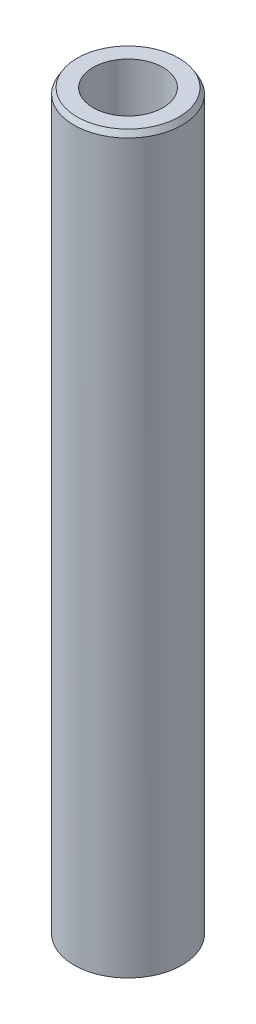
from build123d import *
from OCP.BRepFilletAPI import BRepFilletAPI_MakeChamfer

# Parameters (mm, degrees)
SKETCH1_R           = 7.5
BOSS_EXTRUDE1_DEPTH = 102.049210947
SKETCH2_R           = 4.845715464
CUT_EXTRUDE1_DEPTH  = 103.59893496
CHAMFER1_SIZE       = 0.762633897
CHAMFER1_SIZE2      = 0.440306886


with BuildPart() as part:
    # Sketch1 → Boss-Extrude1 (new body)
    with BuildSketch(Plane(origin=(0, 0, 0), x_dir=(1, 0, 0), z_dir=(0, 1, 0))):
        Circle(SKETCH1_R)
    extrude(amount=BOSS_EXTRUDE1_DEPTH)

    # Sketch2 → Cut-Extrude1 (cut, through all)
    with BuildSketch(Plane(origin=(0, 0, 0), x_dir=(1, 0, 0), z_dir=(0, 1, 0))):
        Circle(SKETCH2_R)
    extrude(amount=CUT_EXTRUDE1_DEPTH, mode=Mode.SUBTRACT)

    # Chamfer1: one chamfer whose edges measure the first distance from different faces: ONE call of the kernel's chamfer builder (chamfer() names one face for all edges)
    chamfer1_edges_1 = [part.edges().sort_by_distance(p)[0] for p in [
        (-7.5, 102.049210947, 0),
    ]]
    chamfer1_side_1 = [part.faces().sort_by_distance(p)[0] for p in [
        (-7.5, 51.024605473, 0),
    ]]
    chamfer1_edges_2 = [part.edges().sort_by_distance(p)[0] for p in [
        (-7.5, 0, 0),
    ]]
    chamfer1_side_2 = [part.faces().sort_by_distance(p)[0] for p in [
        (-7.287867966, 0, 0),
    ]]
    chamfer1 = BRepFilletAPI_MakeChamfer(part.part.solid().wrapped)
    for e in chamfer1_edges_1:
        chamfer1.Add(CHAMFER1_SIZE, CHAMFER1_SIZE2, e.wrapped, chamfer1_side_1[0].wrapped)  # the first distance lies on this face
    for e in chamfer1_edges_2:
        chamfer1.Add(CHAMFER1_SIZE, CHAMFER1_SIZE2, e.wrapped, chamfer1_side_2[0].wrapped)  # the first distance lies on this face
    add(Compound.cast(chamfer1.Shape()), mode=Mode.REPLACE)


solid = part.part
